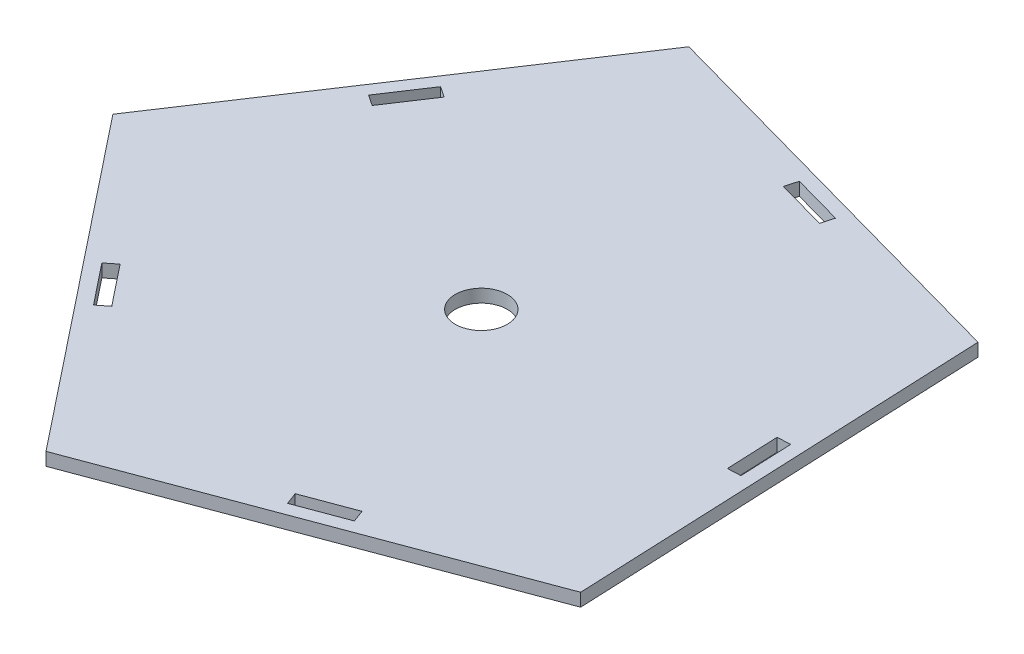
from build123d import *

# Parameters (mm, degrees)
BOSS_EXTRUDE1_DEPTH = 6.35
CUT_EXTRUDE1_DEPTH  = 406.579889612
SKETCH3_R           = 12.7
CUT_EXTRUDE2_DEPTH  = 406.579889612


with BuildPart() as part:
    # Sketch1 → Boss-Extrude1 (new body)
    with BuildSketch(Plane(origin=(0, 0, 0), x_dir=(1, 0, 0), z_dir=(0, 1, 0))):
        Polygon((-20.875255467, -32.826433561), (-29.617127229, 170.18543722), (-225.394276758, 224.605541248), (-337.649337625, 55.227144427), (-211.249631122, -103.874565796), align=None)
    extrude(amount=BOSS_EXTRUDE1_DEPTH)

    # Sketch2 → Cut-Extrude1 (cut, through all)
    with BuildSketch(Plane(origin=(0, 6.35, 0), x_dir=(1, 0, 0), z_dir=(0, 1, 0))):
        Polygon((-132.401350038, -60.892609465), (-108.604553081, -52.011592936), (-106.384298948, -57.960792175), (-130.181095905, -66.841808704), align=None)
        Polygon((-277.377537586, -10.429862968), (-261.577574273, -30.317576745), (-256.605645828, -26.367585917), (-272.405609141, -6.479872139), align=None)
        Polygon((-283.244673595, 125.822222384), (-277.951598695, 122.314251732), (-263.919716086, 143.486551334), (-269.212790987, 146.994521986), align=None)
        Polygon((-141.44240209, 194.678709813), (-116.970258399, 187.876196809), (-118.67088665, 181.758160887), (-143.143030341, 188.56067389), align=None)
        Polygon((-38.480800257, 80.821376768), (-32.136679295, 81.094560261), (-31.043945325, 55.718076413), (-37.388066287, 55.444892921), align=None)
    extrude(amount=-CUT_EXTRUDE1_DEPTH, mode=Mode.SUBTRACT)

    # Sketch3 → Cut-Extrude2 (cut, through all)
    with BuildSketch(Plane(origin=(0, 6.35, 0), x_dir=(1, 0, 0), z_dir=(0, 1, 0))):
        with Locations((-164.95712564, 62.663424707)):
            Circle(SKETCH3_R)
    extrude(amount=-CUT_EXTRUDE2_DEPTH, mode=Mode.SUBTRACT)


solid = part.part
